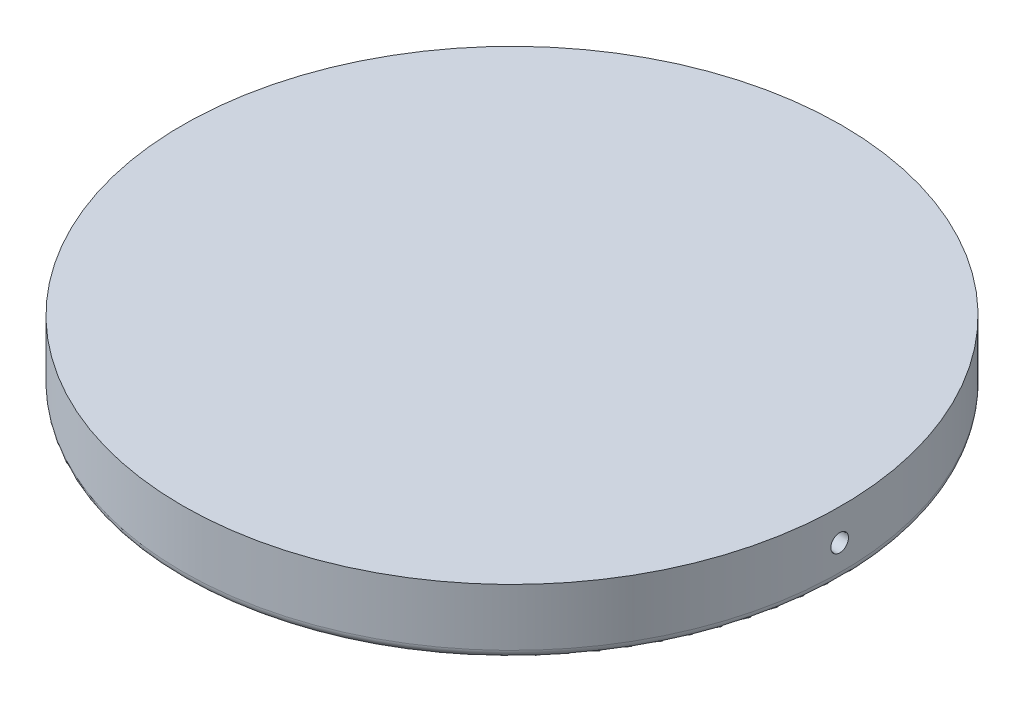
from build123d import *

# Parameters (mm, degrees)
SKETCH_1_R            = 75
EXTRUDE_1_DEPTH       = 15
SKETCH_2_R            = 10
CUT_EXTRUDE_2_DEPTH   = 10
FILLET_1_R            = 2
CHAMFER_1_SIZE        = 1
SKETCH_3_R            = 6.5
CUT_EXTRUDE_3_DEPTH   = 2
CUT_EXTRUDE_START     = 69.96131425
CUT_EXTRUDE_9_DEPTH   = 6.03868575
CUT_EXTRUDE_START_2   = 5
CUT_EXTRUDE_9_2_DEPTH = 6


with BuildPart() as part:
    # 草图1 → 凸台-拉伸1 (new body)
    with BuildSketch(Plane(origin=(0, 0, 0), x_dir=(1, 0, 0), z_dir=(0, 1, 0))):
        with Locations(Location((0, 0, 0), (0, 0, 270))):
            Circle(SKETCH_1_R)
    extrude(amount=EXTRUDE_1_DEPTH)

    # 草图2 → 切除-拉伸2 (cut)
    with BuildSketch(Plane(origin=(0, 0, 0), x_dir=(1, 0, 0), z_dir=(0, 1, 0))):
        with Locations(Location((-35, 0, 0), (0, 0, 270))):
            Circle(SKETCH_2_R)
    extrude(amount=CUT_EXTRUDE_2_DEPTH, mode=Mode.SUBTRACT)

    # 圆角1
    fillet_1_edges = [part.edges().sort_by_distance(p)[0] for p in [
        (0, 0, -75),
    ]]
    fillet(fillet_1_edges, radius=FILLET_1_R)

    # 倒角1
    chamfer_1_edges = [part.edges().sort_by_distance(p)[0] for p in [
        (-35, 0, -10),
    ]]
    chamfer(chamfer_1_edges, length=CHAMFER_1_SIZE)

    # 草图3 → 切除-拉伸3 (cut)
    with BuildSketch(Plane.XZ):
        with Locations(Location((30, 0, 0), (0, 0, 270))):
            Circle(SKETCH_3_R)
    extrude(amount=-CUT_EXTRUDE_3_DEPTH, mode=Mode.SUBTRACT)

    # 切除-拉伸9: read off the stored shape, not the designer's step
    # 切除-拉伸9 outline → 切除-拉伸9 (cut)
    with BuildSketch(Plane(origin=(0, 0, 0), x_dir=(0, 0, -1), z_dir=(1, 0, 0)).offset(CUT_EXTRUDE_START)):
        with BuildLine():
            add(Edge.make_bspline(
                [(-2.408599358, 7.908599358), (-2.408599358, 7.380050553), (-2.19172637, 6.863241712), (-1.453678928, 6.125309354), (-0.931504849, 5.908902276), (0.111986372, 5.908297113), (0.631291702, 6.120458395), (1.378441313, 6.866818593), (1.591215997, 7.385801707), (1.591585037, 8.429983307), (1.375428682, 8.952297025), (0.638483078, 9.690642916), (0.120902782, 9.908088408), (-0.93423459, 9.909108439), (-1.452163157, 9.692883252), (-2.191245952, 8.954957584), (-2.408599358, 8.437148163), (-2.408599358, 7.908599358)],
                knots=[0, 0, 0, 0, 0.125, 0.125, 0.25, 0.25, 0.375, 0.375, 0.5, 0.5, 0.625, 0.625, 0.75, 0.75, 0.875, 0.875, 1, 1, 1, 1], degree=3))
        make_face()
    extrude(amount=CUT_EXTRUDE_9_DEPTH, mode=Mode.SUBTRACT)

    # Cut-Extrude 9 2 outline → Cut-Extrude 9 2 (add)
    with BuildSketch(Plane(origin=(0, 0, 0), x_dir=(1, 0, 0), z_dir=(0, 1, 0)).offset(CUT_EXTRUDE_START_2)):
        with BuildLine():
            ThreePointArc((69.96131435, -2.408599358), (69.998905417, -0.405199028), (69.982963585, 1.598490525))
            Line((69.982963585, 1.598490525), (69.96131425, 2.614030645))
            Line((69.96131425, 2.614030645), (69.96131435, -2.408599358))
        make_face()
    extrude(amount=CUT_EXTRUDE_9_2_DEPTH)


solid = part.part
